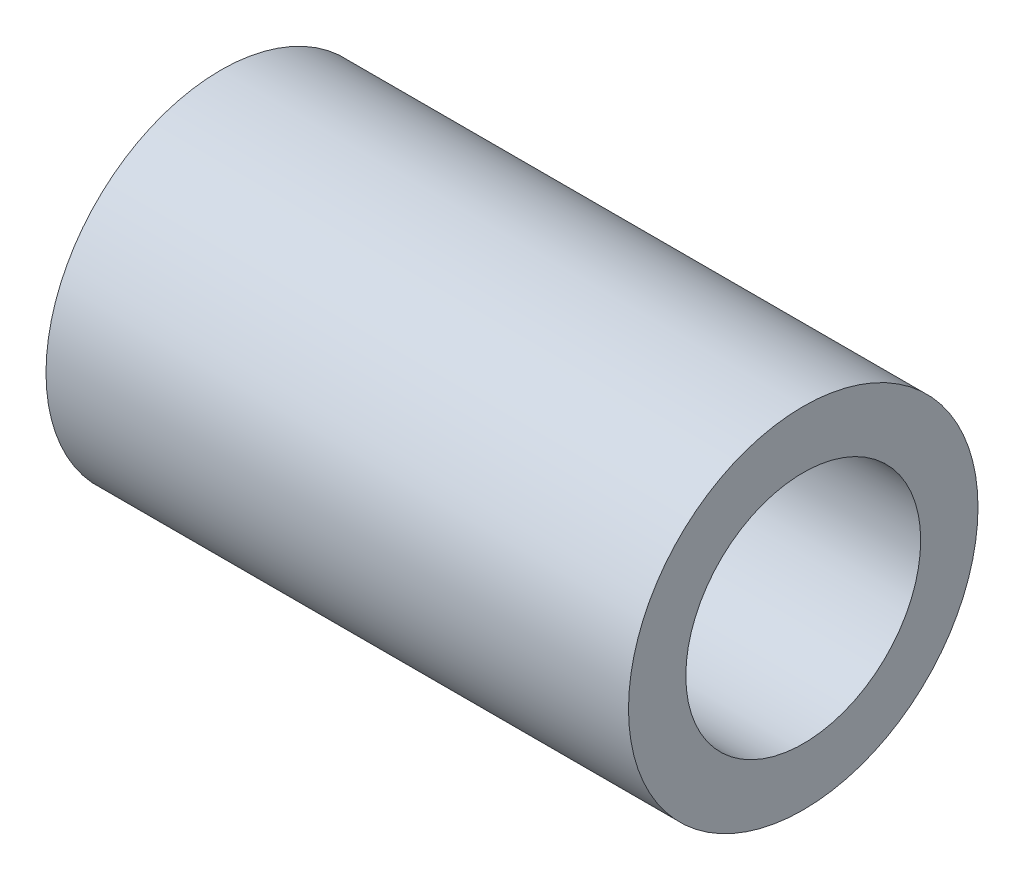
from build123d import *

# Parameters (mm, degrees)
SKETCH1_R           = 4.7625
BOSS_EXTRUDE1_DEPTH = 15.875
SKETCH2_R           = 3.2004
CUT_EXTRUDE1_DEPTH  = 15.875


with BuildPart() as part:
    # Sketch1 → Boss-Extrude1 (new body)
    with BuildSketch(Plane(origin=(0, 0, 0), x_dir=(0, 0, -1), z_dir=(1, 0, 0))):
        Circle(SKETCH1_R)
    extrude(amount=BOSS_EXTRUDE1_DEPTH)

    # Sketch2 → Cut-Extrude1 (cut)
    with BuildSketch(Plane.ZY):
        Circle(SKETCH2_R)
    extrude(amount=-CUT_EXTRUDE1_DEPTH, mode=Mode.SUBTRACT)


solid = part.part
